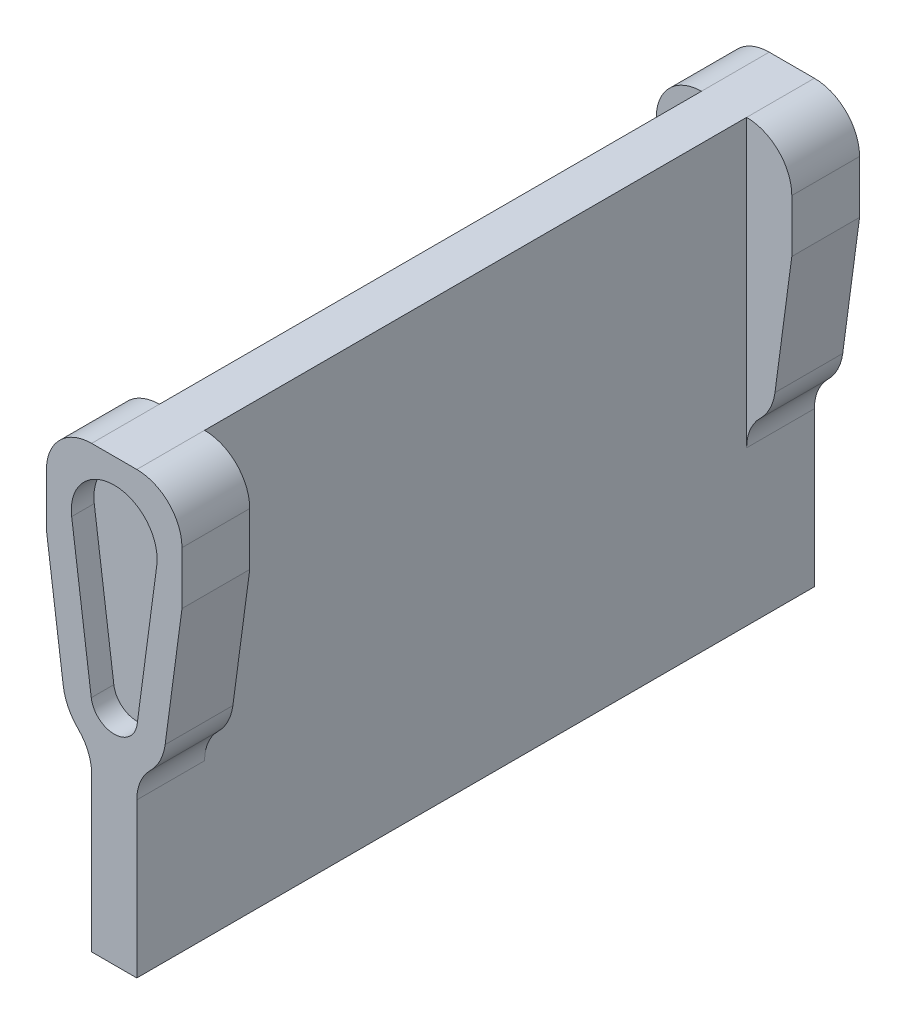
from build123d import *

# Parameters (mm, degrees)
BOSS_EXTRUDE2_DEPTH     = 39
CUT_EXTRUDE1_DEPTH      = 2
FILLET1_R               = 4
CUT_EXTRUDE3_DEPTH      = 46
CUT_EXTRUDE3_DEPTH_BACK = 46
BOSS_EXTRUDE3_DEPTH     = 22
FILLET3_R               = 2


with BuildPart() as part:
    # Sketch4 → Boss-Extrude2 (new body)
    with BuildSketch(Plane(origin=(0, 6, 0), x_dir=(1, 0, 0), z_dir=(0, 1, 0))):
        Polygon((-6, 30), (6, 30), (6, 24), (2, 24), (2, -24), (6, -24), (6, -30), (-6, -30), (-6, -24), (-2, -24), (-2, 24), (-6, 24), align=None)
    extrude(amount=-BOSS_EXTRUDE2_DEPTH)

    # Sketch5 → Cut-Extrude1 (cut)
    with BuildSketch(Plane.XY.offset(30)):
        with BuildLine():
            Line((3.76671072, -0.501886792), (2.032041309, -13.520754717))
            ThreePointArc((2.032041309, -13.520754717), (0, -15.3), (-2.032041309, -13.520754717))
            Line((-2.032041309, -13.520754717), (-3.76671072, -0.501886792))
            ThreePointArc((-3.76671072, -0.501886792), (0, 3.8), (3.76671072, -0.501886792))
        make_face()
    cut_extrude1 = extrude(amount=-CUT_EXTRUDE1_DEPTH, mode=Mode.SUBTRACT)

    # Mirror1: Cut-Extrude1 across plane
    add(cut_extrude1.mirror(Plane.XY), mode=Mode.SUBTRACT)

    # Fillet1
    fillet1_edges = [part.edges().sort_by_distance(p)[0] for p in [
        (-6, 6, -27),
        (6, 6, -27),
        (6, 6, 27),
        (-6, 6, 27),
    ]]
    fillet(fillet1_edges, radius=FILLET1_R)

    # Sketch8 → Cut-Extrude3 (cut, two sides: drawn at the far end of the back side and taken through both)
    with BuildSketch(Plane.XY.offset(-CUT_EXTRUDE3_DEPTH_BACK)):
        with BuildLine():
            Line((4.510140467, -13.850943396), (6, -2.66939816))
            Line((6, -2.66939816), (6, -33))
            Line((6, -33), (2, -33))
            Line((2, -33), (2, -19.341182151))
            ThreePointArc((2, -19.341182151), (2.310279809, -17.79652526), (3.192982456, -16.491506291))
            ThreePointArc((3.192982456, -16.491506291), (4.071568346, -15.280968047), (4.510140467, -13.850943396))
        make_face()
        with BuildLine():
            Line((-6, -2.66939816), (-4.510140467, -13.850943396))
            ThreePointArc((-4.510140467, -13.850943396), (-4.071568346, -15.280968047), (-3.192982456, -16.491506291))
            ThreePointArc((-3.192982456, -16.491506291), (-2.310279809, -17.79652526), (-2, -19.341182151))
            Line((-2, -19.341182151), (-2, -33))
            Line((-2, -33), (-6, -33))
            Line((-6, -33), (-6, -2.66939816))
        make_face()
    extrude(amount=CUT_EXTRUDE3_DEPTH + CUT_EXTRUDE3_DEPTH_BACK, mode=Mode.SUBTRACT)

    # Sketch10 → Boss-Extrude3 (add, symmetric)
    with BuildSketch(Plane.XY):
        Polygon((-2, -33), (-2, -30.579274058), (-5.5, -32.6), (-5.5, -33), align=None)
    extrude(amount=BOSS_EXTRUDE3_DEPTH, both=True)

    # Fillet3
    fillet3_edges = [part.edges().sort_by_distance(p)[0] for p in [
        (-2, -30.579274058, 0),
    ]]
    fillet(fillet3_edges, radius=FILLET3_R)


solid = part.part
